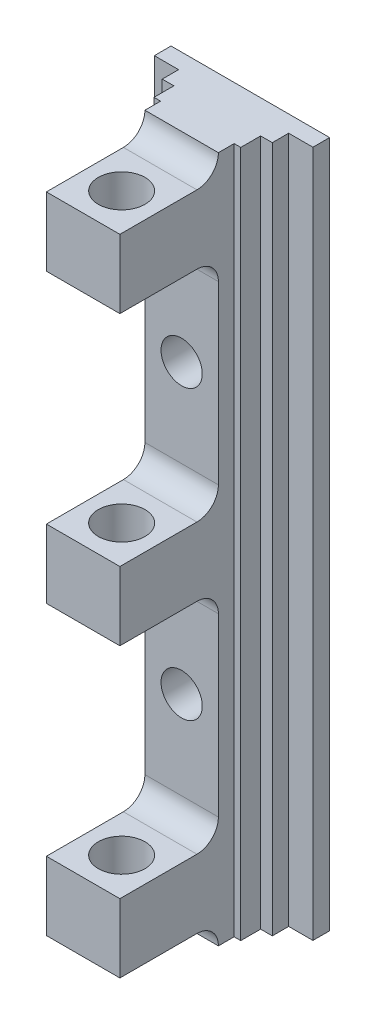
from build123d import *

# Parameters (mm, degrees)
SKETCH1_W                            = 5.4356
SKETCH1_H                            = 5.08
BOSS_EXTRUDE1_DEPTH                  = 50.8
SKETCH4_W                            = 5.4356
SKETCH4_H                            = 7.283958
BOSS_EXTRUDE3_DEPTH                  = 5.08
SKETCH13_W                           = 7.283958
SKETCH13_H                           = 5.08
BOSS_EXTRUDE6_DEPTH                  = 5.4356
FILLET1_R                            = 1.5875
F_4_CLEARANCE_HOLE1_D                = 3.4544
FILLET1_OF_MIRROR5_R                 = 1.5875
BOSS_EXTRUDE4_DEPTH                  = 50.8
TAPPED_HOLE_FOR_4_40_HELICOIL1_D     = 3.048
TAPPED_HOLE_FOR_4_40_HELICOIL1_DEPTH = 5.08
TAPPED_HOLE_FOR_4_40_HELICOIL1_TIP   = 0.915711583


with BuildPart() as part:
    # Sketch1 → Boss-Extrude1 (new body)
    with BuildSketch(Plane(origin=(0, 0, 0), x_dir=(1, 0, 0), z_dir=(0, 1, 0))):
        Rectangle(SKETCH1_W, SKETCH1_H)
    extrude(amount=-BOSS_EXTRUDE1_DEPTH)

    # Sketch4 → Boss-Extrude3 (add)
    with BuildSketch(Plane(origin=(0, -1.5875, 0), x_dir=(1, 0, 0), z_dir=(0, 1, 0))):
        with Locations((0, -6.181979)):
            Rectangle(SKETCH4_W, SKETCH4_H)
    boss_extrude3 = extrude(amount=-BOSS_EXTRUDE3_DEPTH)

    # Sketch13 → Boss-Extrude6 (add)
    with BuildSketch(Plane(origin=(2.7178, 0, 0), x_dir=(0, 0, -1), z_dir=(1, 0, 0))):
        with Locations((-6.181979, -25.4)):
            Rectangle(SKETCH13_W, SKETCH13_H)
    extrude(amount=-BOSS_EXTRUDE6_DEPTH)

    # Fillet1
    fillet1_edges = [part.edges().sort_by_distance(p)[0] for p in [
        (0, -6.6675, 2.54),
        (0, -1.5875, 2.54),
        (0, -27.94, 2.54),
        (0, -22.86, 2.54),
    ]]
    fillet(fillet1_edges, radius=FILLET1_R - 0.0001)  # a hair under: the kernel refuses the full size

    # #4 Clearance Hole1 (through all)
    with Locations(Plane(origin=(0, 0, 0), x_dir=(1, 0, 0), z_dir=(0, 1, 0))):
        with Locations((0, -6.975729)):
            f_4_clearance_hole1 = Hole(F_4_CLEARANCE_HOLE1_D / 2)

    # Mirror5: Boss-Extrude3, #4 Clearance Hole1 across plane
    add(boss_extrude3.mirror(Plane.ZX.offset(-25.4)))
    add(f_4_clearance_hole1.mirror(Plane.ZX.offset(-25.4)), mode=Mode.SUBTRACT)

    # Fillet1 of Mirror5
    fillet1_of_mirror5_edges = [part.edges().sort_by_distance(p)[0] for p in [
        (0, -44.1325, 2.54),
        (0, -49.2125, 2.54),
        (0, -21.2726, 2.54),
        (0, -27.94, 4.1274),
    ]]
    fillet(fillet1_of_mirror5_edges, radius=FILLET1_OF_MIRROR5_R - 0.0001)  # a hair under: the kernel refuses the full size

    # Sketch7 → Boss-Extrude4 (add)
    with BuildSketch(Plane(origin=(0, 0, 0), x_dir=(1, 0, 0), z_dir=(0, 1, 0))):
        Polygon((3.207601712, -1.376528509), (3.207601712, 0.095381072), (4.069572105, 0.095381072), (4.069572105, 1.304918523), (5.863211288, 1.304918523), (5.863211288, 2.54), (2.7178, 2.54), (2.7178, -1.376528509), align=None)
    boss_extrude4 = extrude(amount=-BOSS_EXTRUDE4_DEPTH)

    # Mirror6: Boss-Extrude4 across plane
    add(boss_extrude4.mirror(Plane(origin=(0, 0, 0), x_dir=(0, 0, 1), z_dir=(1, 0, 0))))

    # Tapped Hole for #4-40 Helicoil1
    with Locations(Plane(origin=(0, 0, -2.54), x_dir=(-1, 0, 0), z_dir=(0, 0, -1))):
        with Locations((0, -4.1275), (0, -46.6725), (0, -25.4), (0, -14.76375), (0, -36.03625)):
            Hole(TAPPED_HOLE_FOR_4_40_HELICOIL1_D / 2, depth=TAPPED_HOLE_FOR_4_40_HELICOIL1_DEPTH)
            with Locations((0, 0, -(TAPPED_HOLE_FOR_4_40_HELICOIL1_DEPTH + TAPPED_HOLE_FOR_4_40_HELICOIL1_TIP / 2))):  # 118° drill point
                Cone(0, TAPPED_HOLE_FOR_4_40_HELICOIL1_D / 2, TAPPED_HOLE_FOR_4_40_HELICOIL1_TIP, mode=Mode.SUBTRACT)


solid = part.part
